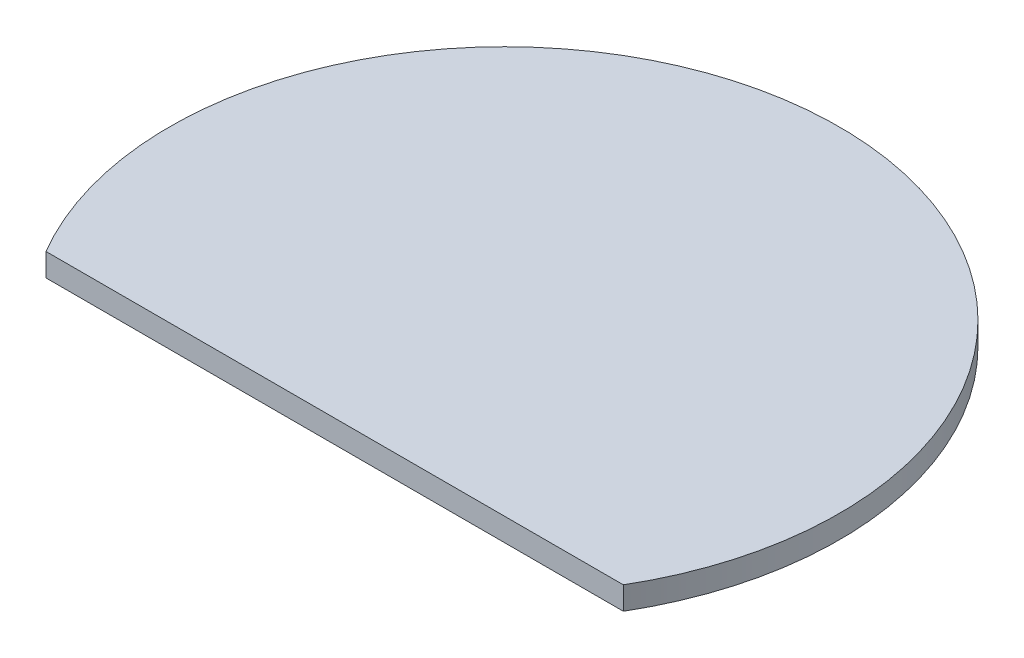
from build123d import *

# Parameters (mm, degrees)
BOSS_EXTRUDE1_DEPTH = 1


with BuildPart() as part:
    # Sketch1 → Boss-Extrude1 (new body)
    with BuildSketch(Plane(origin=(0, 0, 0), x_dir=(1, 0, 0), z_dir=(0, 1, 0))):
        with BuildLine():
            Line((-12.585706178, -7.4), (12.585706178, -7.4))
            ThreePointArc((12.585706178, -7.4), (0, 14.6), (-12.585706178, -7.4))
        make_face()
    extrude(amount=BOSS_EXTRUDE1_DEPTH)


solid = part.part
